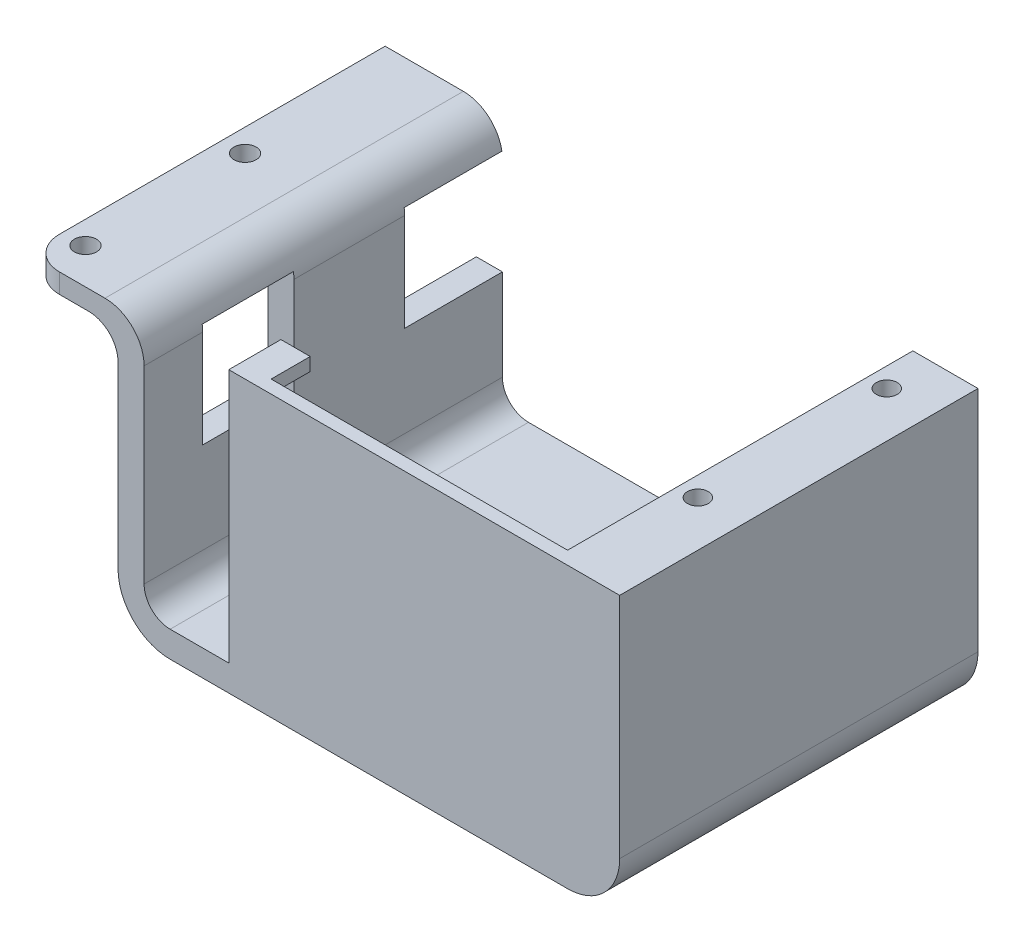
from build123d import *

# Parameters (mm, degrees)
EXTRUDE_1_DEPTH      = 54
EXTRUDE_START        = -2
EXTRUDE_2_DEPTH      = 2
SKETCH_2_R           = 1.7
SKETCH_2_W           = 14
SKETCH_2_H           = 2
SKETCH_2_W_2         = 8
SKETCH_2_W_3         = 61
CUT_EXTRUDE_1_DEPTH  = 101.468900661
CUT_EXTRUDE_2_REACH  = 103.814
SKETCH_3_W           = 15
SKETCH_3_H           = 16
SKETCH_3_W_2         = 14
CUT_EXTRUDE_START    = -40
CUT_EXTRUDE_5_DEPTH  = 61.468900661
EXTRUDE_3_DEPTH      = 1
EXTRUDE_3_DEPTH_BACK = 1
SKETCH_6_W           = 4.5
SKETCH_6_H           = 2
EXTRUDE_4_DEPTH      = 6
FILLET_1_R           = 4.5
FILLET_2_R           = 6
FILLET_3_R           = 5


with BuildPart() as part:
    # 草图1 → 凸台-拉伸1 (new body)
    with BuildSketch(Plane.XY):
        with BuildLine():
            ThreePointArc((4, -4), (-1.656854249, -1.656854249), (-4, 4))
            Line((-4, 4), (-4, 36))
            Line((-4, 36), (-18, 36))
            Line((-18, 36), (-18, 39))
            Line((-18, 39), (0, 39))
            Line((0, 39), (0, 4))
            ThreePointArc((0, 4), (1.171572875, 1.171572875), (4, 0))
            Line((4, 0), (65, 0))
            ThreePointArc((65, 0), (67.828427125, 1.171572875), (69, 4))
            Line((69, 4), (69, 36))
            Line((69, 36), (63, 36))
            Line((63, 36), (63, 39))
            Line((63, 39), (73, 39))
            Line((73, 39), (73, 4))
            ThreePointArc((73, 4), (70.656854249, -1.656854249), (65, -4))
            Line((65, -4), (4, -4))
        make_face()
    extrude(amount=EXTRUDE_1_DEPTH)

    # 草图1<3> → 凸台-拉伸2 (add)
    with BuildSketch(Plane.XY.offset(EXTRUDE_START)):
        with BuildLine():
            Line((4, 0), (65, 0))
            ThreePointArc((65, 0), (67.828427125, 1.171572875), (69, 4))
            Line((69, 4), (69, 36))
            Line((69, 36), (63, 36))
            Line((63, 36), (63, 39))
            Line((63, 39), (0, 39))
            Line((0, 39), (0, 4))
            ThreePointArc((0, 4), (1.171572875, 1.171572875), (4, 0))
        make_face()
        with BuildLine():
            ThreePointArc((4, -4), (-1.656854249, -1.656854249), (-4, 4))
            Line((-4, 4), (-4, 36))
            Line((-4, 36), (-18, 36))
            Line((-18, 36), (-18, 39))
            Line((-18, 39), (0, 39))
            Line((0, 39), (0, 4))
            ThreePointArc((0, 4), (1.171572875, 1.171572875), (4, 0))
            Line((4, 0), (65, 0))
            ThreePointArc((65, 0), (67.828427125, 1.171572875), (69, 4))
            Line((69, 4), (69, 36))
            Line((69, 36), (63, 36))
            Line((63, 36), (63, 39))
            Line((63, 39), (73, 39))
            Line((73, 39), (73, 4))
            ThreePointArc((73, 4), (70.656854249, -1.656854249), (65, -4))
            Line((65, -4), (4, -4))
        make_face()
    extrude(amount=EXTRUDE_2_DEPTH)

    # 草图2 → 切除-拉伸1 (cut, through all)
    with BuildSketch(Plane.XZ.offset(4)):
        with Locations(Location((-14.5, 49.5, 0), (0, 0, 90))):
            Circle(SKETCH_2_R)
        with Locations(Location((-14.5, 25, 0), (0, 0, 90))):
            Circle(SKETCH_2_R)
        with Locations((-11, -1)):
            Rectangle(SKETCH_2_W, SKETCH_2_H)
        with Locations((0, -1)):
            Rectangle(SKETCH_2_W_2, SKETCH_2_H)
        with Locations((34.5, -1)):
            Rectangle(SKETCH_2_W_3, SKETCH_2_H)
        with Locations((69, -1)):
            Rectangle(SKETCH_2_W_2, SKETCH_2_H)
    extrude(amount=-CUT_EXTRUDE_1_DEPTH, mode=Mode.SUBTRACT)

    # 草图3 → 切除-拉伸2 (cut, up to next)
    with BuildSketch(Plane.ZY.offset(4), mode=Mode.PRIVATE) as cut_extrude_2_sk1:
        with Locations((7.5, 26)):
            Rectangle(SKETCH_3_W, SKETCH_3_H)
    cut_extrude_2_tool1 = extrude(cut_extrude_2_sk1.sketch, amount=-CUT_EXTRUDE_2_REACH, mode=Mode.PRIVATE) & part.part
    # 草图3 → 切除-拉伸2 (cut, up to next)
    with BuildSketch(Plane.ZY.offset(4), mode=Mode.PRIVATE) as cut_extrude_2_sk2:
        with Locations((39, 26)):
            Rectangle(SKETCH_3_W_2, SKETCH_3_H)
    cut_extrude_2_tool2 = extrude(cut_extrude_2_sk2.sketch, amount=-CUT_EXTRUDE_2_REACH, mode=Mode.PRIVATE) & part.part
    add(cut_extrude_2_tool1.solids().sort_by_distance((-4, 26, 7.5))[0], mode=Mode.SUBTRACT)
    add(cut_extrude_2_tool2.solids().sort_by_distance((-4, 26, 39))[0], mode=Mode.SUBTRACT)

    # 草图2<3> → 切除-拉伸5 (cut, through all)
    with BuildSketch(Plane.XZ.offset(4).offset(CUT_EXTRUDE_START)):
        with BuildLine():
            ThreePointArc((65, 37.2489996), (64.4, 36), (65, 34.7510004))
            Line((65, 34.7510004), (65, 37.2489996))
        make_face()
        with BuildLine():
            Line((65, 37.2489996), (65, 34.7510004))
            ThreePointArc((65, 34.7510004), (66.692820323, 34.55777949), (67.6, 36))
            ThreePointArc((67.6, 36), (66.692820323, 37.44222051), (65, 37.2489996))
        make_face()
        with BuildLine():
            ThreePointArc((65, 8.2489996), (64.4, 7), (65, 5.7510004))
            Line((65, 5.7510004), (65, 8.2489996))
        make_face()
        with BuildLine():
            Line((65, 8.2489996), (65, 5.7510004))
            ThreePointArc((65, 5.7510004), (66.692820323, 5.55777949), (67.6, 7))
            ThreePointArc((67.6, 7), (66.692820323, 8.44222051), (65, 8.2489996))
        make_face()
    extrude(amount=-CUT_EXTRUDE_5_DEPTH, mode=Mode.SUBTRACT)

    # 草图5 → 凸台-拉伸3 (add, two sides: drawn at the far end of the back side and taken through both)
    with BuildSketch(Plane.XY.offset(54).offset(-EXTRUDE_3_DEPTH_BACK)):
        with BuildLine():
            Line((73, 39), (63, 39))
            Line((63, 39), (63, 36))
            Line((63, 36), (69, 36))
            Line((69, 36), (69, 4))
            ThreePointArc((69, 4), (67.828427125, 1.171572875), (65, 0))
            Line((65, 0), (13, 0))
            Line((13, 0), (13, -4))
            Line((13, -4), (65, -4))
            ThreePointArc((65, -4), (70.656854249, -1.656854249), (73, 4))
            Line((73, 4), (73, 39))
        make_face()
        with BuildLine():
            Line((63, 39), (13, 39))
            Line((13, 39), (13, 0))
            Line((13, 0), (65, 0))
            ThreePointArc((65, 0), (67.828427125, 1.171572875), (69, 4))
            Line((69, 4), (69, 36))
            Line((69, 36), (63, 36))
            Line((63, 36), (63, 39))
        make_face()
        with BuildLine():
            Line((0, 4), (0, 39))
            Line((0, 39), (-18, 39))
            Line((-18, 39), (-18, 36))
            Line((-18, 36), (-4, 36))
            Line((-4, 36), (-4, 4))
            ThreePointArc((-4, 4), (-1.656854249, -1.656854249), (4, -4))
            Line((4, -4), (13, -4))
            Line((13, -4), (13, 0))
            Line((13, 0), (4, 0))
            ThreePointArc((4, 0), (1.171572875, 1.171572875), (0, 4))
        make_face()
    extrude(amount=EXTRUDE_3_DEPTH + EXTRUDE_3_DEPTH_BACK)

    # 草图6 → 凸台-拉伸4 (add)
    with BuildSketch(Plane(origin=(0, 0, 53), x_dir=(-1, 0, 0), z_dir=(0, 0, -1))):
        with Locations((-15.25, 38)):
            Rectangle(SKETCH_6_W, SKETCH_6_H)
    extrude(amount=EXTRUDE_4_DEPTH)

    # 圆角1
    # the kernel refuses this fillet: 4.5 mm, written as the material it adds along each edge
    with BuildSketch(Plane(origin=(-4, 36, 55), x_dir=(0, -1, 0), z_dir=(0, 0, -1))) as fillet_1_piece_1_section:
        with BuildLine():
            CenterArc((FILLET_1_R, FILLET_1_R), FILLET_1_R, 180, 90)
            Line((0, FILLET_1_R), (0, 0))
            Line((0, 0), (FILLET_1_R, 0))
        make_face()
    fillet_1_piece_1 = extrude(amount=55, mode=Mode.PRIVATE)
    fillet_1_piece_1 = split(fillet_1_piece_1, bisect_by=Plane(origin=(-4.151275194, 34, 50.5), z_dir=(0, -1, 0)), keep=Keep.TOP, mode=Mode.PRIVATE)
    fillet_1_piece_1 = split(fillet_1_piece_1, bisect_by=Plane(origin=(-4.151275194, 33.214431026, 46), z_dir=(0, 0, 1)), keep=Keep.TOP, mode=Mode.PRIVATE)
    add(fillet_1_piece_1)
    with BuildSketch(Plane(origin=(-4, 36, 55), x_dir=(0, -1, 0), z_dir=(0, 0, -1))) as fillet_1_piece_2_section:
        with BuildLine():
            CenterArc((FILLET_1_R, FILLET_1_R), FILLET_1_R, 180, 90)
            Line((0, FILLET_1_R), (0, 0))
            Line((0, 0), (FILLET_1_R, 0))
        make_face()
    fillet_1_piece_2 = extrude(amount=55, mode=Mode.PRIVATE)
    fillet_1_piece_2 = split(fillet_1_piece_2, bisect_by=Plane(origin=(-5.185873222, 34, 50.5), z_dir=(0, 1, 0)), keep=Keep.TOP, mode=Mode.PRIVATE)
    fillet_1_piece_2 = split(fillet_1_piece_2, bisect_by=Plane(origin=(-5.185873222, 35.321534772, 46), z_dir=(0, 0, 1)), keep=Keep.TOP, mode=Mode.PRIVATE)
    add(fillet_1_piece_2)
    with BuildSketch(Plane(origin=(-4, 36, 55), x_dir=(0, -1, 0), z_dir=(0, 0, -1))) as fillet_1_piece_3_section:
        with BuildLine():
            CenterArc((FILLET_1_R, FILLET_1_R), FILLET_1_R, 180, 90)
            Line((0, FILLET_1_R), (0, 0))
            Line((0, 0), (FILLET_1_R, 0))
        make_face()
    fillet_1_piece_3 = extrude(amount=55, mode=Mode.PRIVATE)
    fillet_1_piece_3 = split(fillet_1_piece_3, bisect_by=Plane(origin=(-5.185873222, 34, 39), z_dir=(0, 1, 0)), keep=Keep.TOP, mode=Mode.PRIVATE)
    fillet_1_piece_3 = split(fillet_1_piece_3, bisect_by=Plane(origin=(-5.185873222, 35.321534772, 46), z_dir=(0, 0, -1)), keep=Keep.TOP, mode=Mode.PRIVATE)
    fillet_1_piece_3 = split(fillet_1_piece_3, bisect_by=Plane(origin=(-5.185873222, 35.321534772, 32), z_dir=(0, 0, 1)), keep=Keep.TOP, mode=Mode.PRIVATE)
    add(fillet_1_piece_3)
    with BuildSketch(Plane(origin=(-4, 36, 55), x_dir=(0, -1, 0), z_dir=(0, 0, -1))) as fillet_1_piece_4_section:
        with BuildLine():
            CenterArc((FILLET_1_R, FILLET_1_R), FILLET_1_R, 180, 90)
            Line((0, FILLET_1_R), (0, 0))
            Line((0, 0), (FILLET_1_R, 0))
        make_face()
    fillet_1_piece_4 = extrude(amount=55, mode=Mode.PRIVATE)
    fillet_1_piece_4 = split(fillet_1_piece_4, bisect_by=Plane(origin=(-4.151275194, 34, 23.5), z_dir=(0, -1, 0)), keep=Keep.TOP, mode=Mode.PRIVATE)
    fillet_1_piece_4 = split(fillet_1_piece_4, bisect_by=Plane(origin=(-4.151275194, 33.214431026, 15), z_dir=(0, 0, 1)), keep=Keep.TOP, mode=Mode.PRIVATE)
    fillet_1_piece_4 = split(fillet_1_piece_4, bisect_by=Plane(origin=(-4.151275194, 33.214431026, 32), z_dir=(0, 0, -1)), keep=Keep.TOP, mode=Mode.PRIVATE)
    add(fillet_1_piece_4)
    with BuildSketch(Plane(origin=(-4, 36, 55), x_dir=(0, -1, 0), z_dir=(0, 0, -1))) as fillet_1_piece_5_section:
        with BuildLine():
            CenterArc((FILLET_1_R, FILLET_1_R), FILLET_1_R, 180, 90)
            Line((0, FILLET_1_R), (0, 0))
            Line((0, 0), (FILLET_1_R, 0))
        make_face()
    fillet_1_piece_5 = extrude(amount=55, mode=Mode.PRIVATE)
    fillet_1_piece_5 = split(fillet_1_piece_5, bisect_by=Plane(origin=(-5.185873222, 34, 23.5), z_dir=(0, 1, 0)), keep=Keep.TOP, mode=Mode.PRIVATE)
    fillet_1_piece_5 = split(fillet_1_piece_5, bisect_by=Plane(origin=(-5.185873222, 35.321534772, 15), z_dir=(0, 0, 1)), keep=Keep.TOP, mode=Mode.PRIVATE)
    fillet_1_piece_5 = split(fillet_1_piece_5, bisect_by=Plane(origin=(-5.185873222, 35.321534772, 32), z_dir=(0, 0, -1)), keep=Keep.TOP, mode=Mode.PRIVATE)
    add(fillet_1_piece_5)
    with BuildSketch(Plane(origin=(-4, 36, 55), x_dir=(0, -1, 0), z_dir=(0, 0, -1))) as fillet_1_piece_6_section:
        with BuildLine():
            CenterArc((FILLET_1_R, FILLET_1_R), FILLET_1_R, 180, 90)
            Line((0, FILLET_1_R), (0, 0))
            Line((0, 0), (FILLET_1_R, 0))
        make_face()
    fillet_1_piece_6 = extrude(amount=55, mode=Mode.PRIVATE)
    fillet_1_piece_6 = split(fillet_1_piece_6, bisect_by=Plane(origin=(-5.185873222, 34, 7.5), z_dir=(0, 1, 0)), keep=Keep.TOP, mode=Mode.PRIVATE)
    fillet_1_piece_6 = split(fillet_1_piece_6, bisect_by=Plane(origin=(-5.185873222, 35.321534772, 15), z_dir=(0, 0, -1)), keep=Keep.TOP, mode=Mode.PRIVATE)
    add(fillet_1_piece_6)

    # 圆角2
    # the kernel refuses this fillet: 6 mm, written as the material it takes off along each edge
    with BuildSketch(Plane(origin=(0, 39, -15), x_dir=(-1, 0, 0), z_dir=(0, 0, 1))) as fillet_2_piece_1:
        with BuildLine():
            CenterArc((FILLET_2_R, FILLET_2_R), FILLET_2_R, 180, 90)
            Line((0, FILLET_2_R), (0, 0))
            Line((0, 0), (FILLET_2_R, 0))
        make_face()
    extrude(amount=85, mode=Mode.SUBTRACT)

    # 圆角3
    fillet_3_edges = [part.edges().sort_by_distance(p)[0] for p in [
        (-18, 37.5, 55),
    ]]
    fillet(fillet_3_edges, radius=FILLET_3_R)


solid = part.part
